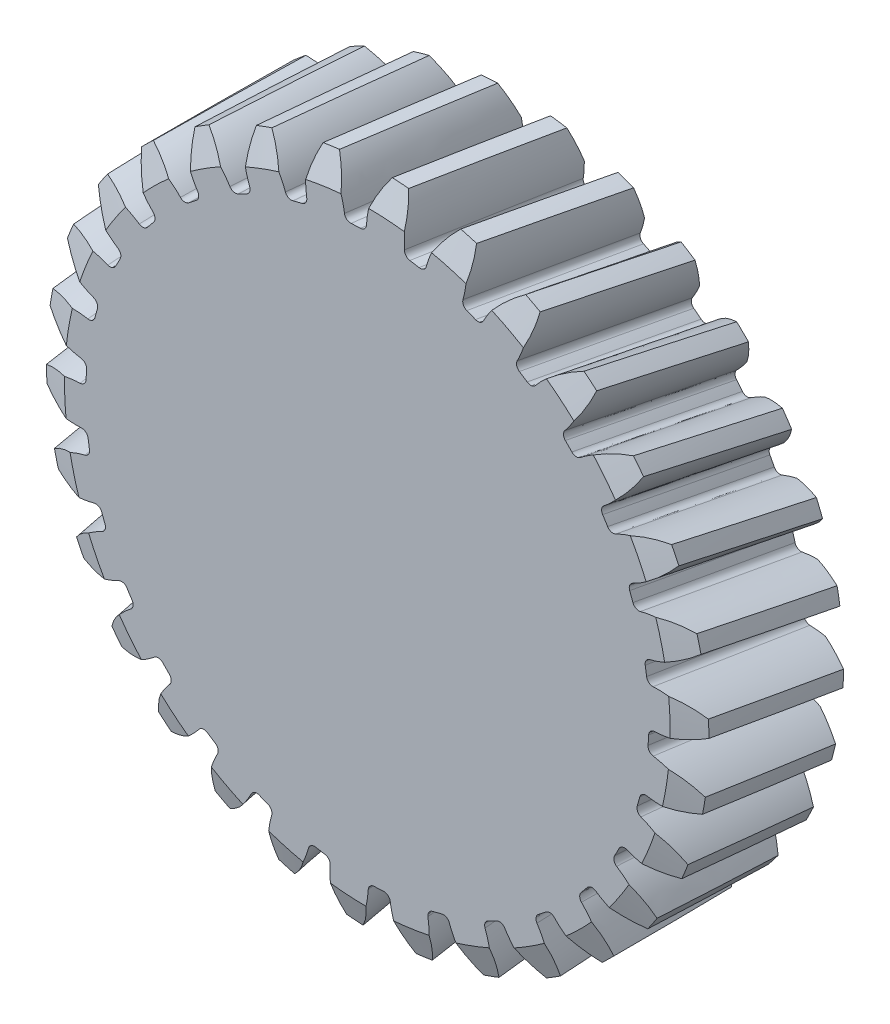
from build123d import *

# Parameters (mm, degrees)
SKETCH1_R                = 16
BOSS_EXTRUDE1_DEPTH      = 3.75
FILLET2_R                = 0.3
CIRPATTERN3_COUNT        = 30
FILLET2_OF_CIRPATTERN3_R = 0.3


with BuildPart() as part:
    # Sketch1 → Boss-Extrude1 (new, symmetric)
    with BuildSketch(Plane.XY):
        Circle(SKETCH1_R)
    extrude(amount=BOSS_EXTRUDE1_DEPTH, both=True)

    # Sketch4 for Cut-Loft1 → Cut-Loft1 section 0
    with BuildSketch(Plane(origin=(0, 0, 3.75), x_dir=(0.9991456896510965, 0.04132663610354652, 0), z_dir=(0, 0, 1))):
        with BuildLine():
            # circular arc as an exact rational Bezier (weights 1, cos(half-angle), 1)
            Bezier((-2.08884202, 16.871180724), (-0.587835643, 15.573255701), (-0.512986858, 13.590321721), weights=[1, 0.917101008, 1])
            Bezier((-0.512986858, 13.590321721), (0, 13.609685171), (0.512986858, 13.590321721), weights=[1, 0.999288362, 1])
            Bezier((0.512986858, 13.590321721), (0.587835643, 15.573255701), (2.08884202, 16.871180724), weights=[1, 0.917101008, 1])
            Bezier((2.08884202, 16.871180724), (0, 17.129802871), (-2.08884202, 16.871180724), weights=[1, 0.992422396, 1])
        make_face()
    # Sketch2 for Cut-Loft1 → Cut-Loft1 section 1
    with BuildSketch(Plane.XY):
        with BuildLine():
            Bezier((-2.08884202, 16.871180724), (-0.587835643, 15.573255701), (-0.512986858, 13.590321721), weights=[1, 0.917101008, 1])
            Bezier((-0.512986858, 13.590321721), (0, 13.609685171), (0.512986858, 13.590321721), weights=[1, 0.999288362, 1])
            Bezier((0.512986858, 13.590321721), (0.587835643, 15.573255701), (2.08884202, 16.871180724), weights=[1, 0.917101008, 1])
            Bezier((2.08884202, 16.871180724), (0, 17.129802871), (-2.08884202, 16.871180724), weights=[1, 0.992422396, 1])
        make_face()
    # Sketch5 for Cut-Loft1 → Cut-Loft1 section 2
    with BuildSketch(Plane(origin=(0, 0, -3.75), x_dir=(0.9991456896510964, -0.041326636103546435, 0), z_dir=(0, 0, 1))):
        with BuildLine():
            Bezier((-2.08884202, 16.871180724), (-0.587835643, 15.573255701), (-0.512986858, 13.590321721), weights=[1, 0.917101008, 1])
            Bezier((-0.512986858, 13.590321721), (0, 13.609685171), (0.512986858, 13.590321721), weights=[1, 0.999288362, 1])
            Bezier((0.512986858, 13.590321721), (0.587835643, 15.573255701), (2.08884202, 16.871180724), weights=[1, 0.917101008, 1])
            Bezier((2.08884202, 16.871180724), (0, 17.129802871), (-2.08884202, 16.871180724), weights=[1, 0.992422396, 1])
        make_face()
    cut_loft1 = loft(mode=Mode.SUBTRACT)

    # Fillet2
    fillet2_edges = [part.edges().sort_by_distance(p)[0] for p in [
        (0.512986858, 13.590321721, 0),
        (-0.512986858, 13.590321721, 0),
    ]]
    fillet(fillet2_edges, radius=FILLET2_R)

    # CirPattern3: Cut-Loft1 ×30 about axis
    cirpattern3_axis = Axis((0, 0, 3.75), (0, 0, 1))
    for i in range(1, CIRPATTERN3_COUNT):
        add(cut_loft1.rotate(cirpattern3_axis, i * 360 / CIRPATTERN3_COUNT), mode=Mode.SUBTRACT)

    # Fillet2 of CirPattern3
    fillet2_of_cirpattern3_edges = [part.edges().sort_by_distance(p)[0] for p in [
        (-2.323809904, 13.39999655, 0),
        (-3.327363632, 13.18668462, 0),
        (-5.059045021, 12.624027229, 0),
        (-5.996318649, 12.206726124, 0),
        (-7.573175596, 11.296327341, 0),
        (-8.403205767, 10.693275122, 0),
        (-9.756322056, 9.474923743, 0),
        (-10.442832471, 8.712476685, 0),
        (-11.513070427, 7.239420511, 0),
        (-12.026057285, 6.35090121, 0),
        (-12.766642374, 4.687519865, 0),
        (-13.083685688, 3.711760877, 0),
        (-13.462250789, 1.930752107, 0),
        (-13.569494245, 0.910398783, 0),
        (-13.569494245, -0.910398783, 0),
        (-13.462250789, -1.930752107, 0),
        (-13.083685688, -3.711760877, 0),
        (-12.766642374, -4.687519865, 0),
        (-12.026057285, -6.35090121, 0),
        (-11.513070427, -7.239420511, 0),
        (-10.442832471, -8.712476685, 0),
        (-9.756322056, -9.474923743, 0),
        (-8.403205767, -10.693275122, 0),
        (-7.573175596, -11.296327341, 0),
        (-5.996318649, -12.206726124, 0),
        (-5.059045021, -12.624027229, 0),
        (-3.327363632, -13.18668462, 0),
        (-2.323809904, -13.39999655, 0),
        (-0.512986858, -13.590321721, 0),
        (0.512986858, -13.590321721, 0),
        (2.323809904, -13.39999655, 0),
        (3.327363632, -13.18668462, 0),
        (5.059045021, -12.624027229, 0),
        (5.996318649, -12.206726124, 0),
        (7.573175596, -11.296327341, 0),
        (8.403205767, -10.693275122, 0),
        (9.756322056, -9.474923743, 0),
        (10.442832471, -8.712476685, 0),
        (11.513070427, -7.239420511, 0),
        (12.026057285, -6.35090121, 0),
        (12.766642374, -4.687519865, 0),
        (13.083685688, -3.711760877, 0),
        (13.462250789, -1.930752107, 0),
        (13.569494245, -0.910398783, 0),
        (13.569494245, 0.910398783, 0),
        (13.462250789, 1.930752107, 0),
        (13.083685688, 3.711760877, 0),
        (12.766642374, 4.687519865, 0),
        (12.026057285, 6.35090121, 0),
        (11.513070427, 7.239420511, 0),
        (10.442832471, 8.712476685, 0),
        (9.756322056, 9.474923743, 0),
        (8.403205767, 10.693275122, 0),
        (7.573175596, 11.296327341, 0),
        (5.996318649, 12.206726124, 0),
        (5.059045021, 12.624027229, 0),
        (3.327363632, 13.18668462, 0),
        (2.323809904, 13.39999655, 0),
    ]]
    fillet(fillet2_of_cirpattern3_edges, radius=FILLET2_OF_CIRPATTERN3_R)

    # Chamfer1: read off the stored shape, not the designer's step
    # Chamfer1 outline → Chamfer1 (revolve, cut)
    with BuildSketch(Plane.XZ):
        Polygon((16, -3.25), (14.62626129, -3.75), (16, -3.75), align=None)
        Polygon((14.62626129, 3.75), (16, 3.25), (16, 3.75), align=None)
    revolve(axis=Axis((0, 0, 0), (0, 0, 1)), mode=Mode.SUBTRACT)


solid = part.part
